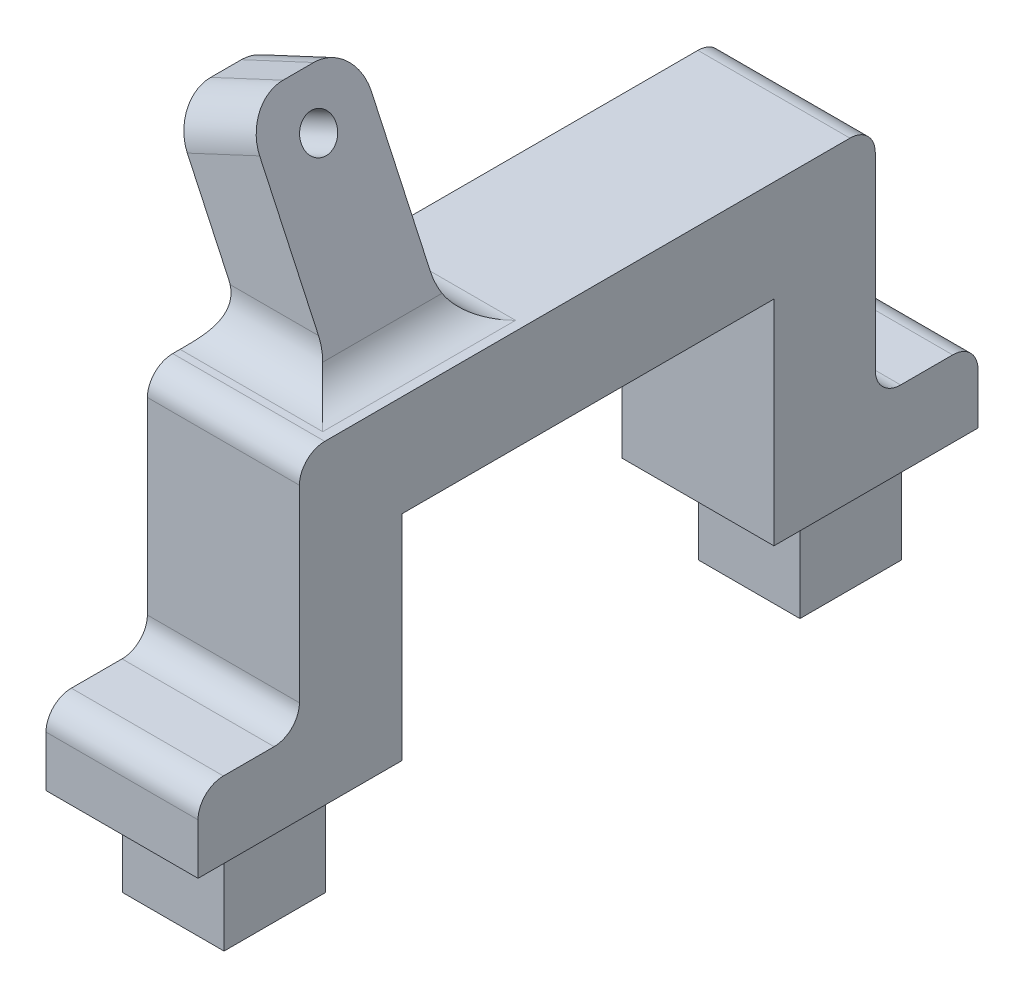
from build123d import *

# Parameters (mm, degrees)
BOSS_EXTRUDE1_DEPTH     = 9.525
SKETCH3_R               = 0.508
CUT_EXTRUDE2_DEPTH      = 6.35
FILLET1_R               = 1.5875
ESQUISSE1_W             = 6.35
ESQUISSE1_H             = 6.35
BOSS_EXTRU_1_DEPTH      = 6.35
ESQUISSE2_W             = 7
ESQUISSE2_H             = 5
BOSS_EXTRU_2_DEPTH      = 15
ESQUISSE3_R             = 1.1
ENL_V_MAT_EXTRU_1_DEPTH = 58.756287679
CONG_1_R                = 2.54


with BuildPart() as part:
    # Sketch1 → Boss-Extrude1 (new body)
    with BuildSketch(Plane(origin=(0, 0, 0), x_dir=(0, 0, -1), z_dir=(1, 0, 0))):
        Polygon((0, 0), (12.7847852, 0), (12.7847852, 13.390245), (36.0778552, 13.390245), (36.0778552, 0), (48.8626404, 0), (48.8626404, 4.7625), (42.4278552, 4.7625), (42.4278552, 19.740245), (41.4309052, 19.740245), (6.3509652, 19.740245), (6.3509652, 4.7625), (0, 4.7625), align=None)
    extrude(amount=BOSS_EXTRUDE1_DEPTH)

    # Sketch3 → Cut-Extrude2 (cut)
    with BuildSketch(Plane.ZY):
        with Locations((-38.3232152, 6.68528)):
            Circle(SKETCH3_R)
        with Locations((-10.5229152, 6.6951225)):
            Circle(SKETCH3_R)
    extrude(amount=-CUT_EXTRUDE2_DEPTH, mode=Mode.SUBTRACT)

    # Fillet1
    fillet1_edges = [part.edges().sort_by_distance(p)[0] for p in [
        (4.7625, 4.7625, 0),
        (4.7625, 4.7625, -6.3509652),
        (4.7625, 19.740245, -6.3509652),
        (4.7625, 19.740245, -42.4278552),
        (4.7625, 4.7625, -42.4278552),
        (4.7625, 4.7625, -48.8626404),
    ]]
    fillet(fillet1_edges, radius=FILLET1_R)

    # Esquisse1 → Boss.-Extru.1 (add)
    with BuildSketch(Plane.XZ):
        with Locations((4.7625, -42.4702478)):
            Rectangle(ESQUISSE1_W, ESQUISSE1_H)
        with Locations((4.7625, -6.3923926)):
            Rectangle(ESQUISSE1_W, ESQUISSE1_H)
    extrude(amount=BOSS_EXTRU_1_DEPTH)

    # Esquisse2 → Boss.-Extru.2 (add)
    with BuildSketch(Plane(origin=(-5.859728485, 12.566228289, 0), x_dir=(0, 0, 1), z_dir=(0.4226182617389464, -0.9063077870374674, 0))):
        with Locations((-14.4384652, -12.4751697)):
            Rectangle(ESQUISSE2_W, ESQUISSE2_H)
    extrude(amount=-BOSS_EXTRU_2_DEPTH)

    # Esquisse3 → Enlèv. mat.-Extru.1 (cut, through all)
    with BuildSketch(Plane(origin=(9.040573976, 4.215688879, 0), x_dir=(0, 0, 1), z_dir=(-0.9063077870367755, -0.4226182617404302, 0))):
        with Locations(Location((-14.4384652, 25.865298818, 0), (0, 0, 270))):
            Circle(ESQUISSE3_R)
    extrude(amount=-ENL_V_MAT_EXTRU_1_DEPTH, mode=Mode.SUBTRACT)

    # Congé1
    # the kernel refuses this fillet: 2.54 mm, written as the material it adds along each edge
    with BuildSketch(Plane(origin=(7.318244162, 19.740245, -10.9384652), x_dir=(1, 0, 0), z_dir=(0, 0, -1))) as cong_1_piece_1:
        with BuildLine():
            CenterArc((CONG_1_R * 0.637070260809, -CONG_1_R), CONG_1_R, 90, 65)
            Line((-CONG_1_R * 0.269237526229, -CONG_1_R * 0.577381738261), (0, 0))
            Line((0, 0), (CONG_1_R * 0.637070260809, 0))
        make_face()
    extrude(amount=7)
    with BuildSketch(Plane(origin=(-4.548645433, 19.740245, -10.9384652), x_dir=(0, 0, 1), z_dir=(1, 0, 0))) as cong_1_piece_2_section:
        with BuildLine():
            CenterArc((CONG_1_R, -CONG_1_R), CONG_1_R, 90, 90)
            Line((0, -CONG_1_R), (0, 0))
            Line((0, 0), (CONG_1_R, 0))
        make_face()
    cong_1_piece_2 = extrude(amount=18.216889595, mode=Mode.PRIVATE)
    cong_1_piece_2 = split(cong_1_piece_2, bisect_by=Plane(origin=(5.198744163, 24.285527416, -10.9384652), z_dir=(-0.9063077870374674, -0.4226182617389464, 0)), keep=Keep.TOP, mode=Mode.PRIVATE)
    cong_1_piece_2 = split(cong_1_piece_2, bisect_by=Plane(origin=(0.667205228, 22.172436107, -10.9384652), z_dir=(0.9063077870374674, 0.4226182617389464, 0)), keep=Keep.TOP, mode=Mode.PRIVATE)
    add(cong_1_piece_2)
    with BuildSketch(Plane(origin=(1.801354567, 19.740245, -17.9384652), x_dir=(-1, 0, 0), z_dir=(0, 0, 1))) as cong_1_piece_3:
        with BuildLine():
            CenterArc((3.626366432, -1.766615888), CONG_1_R, 135.931485235, 69.068514765)
            Line((1.324344653, -2.840066273), (0, 0))
            Line((0, 0), (1.801354567, 0))
        make_face()
    extrude(amount=7)
    with BuildSketch(Plane(origin=(13.668244162, 19.740245, -17.9384652), x_dir=(0, 0, -1), z_dir=(-1, 0, 0))) as cong_1_piece_4_section:
        with BuildLine():
            CenterArc((CONG_1_R, -CONG_1_R), CONG_1_R, 90, 90)
            Line((0, -CONG_1_R), (0, 0))
            Line((0, 0), (CONG_1_R, 0))
        make_face()
    cong_1_piece_4 = extrude(amount=18.216889595, mode=Mode.PRIVATE)
    cong_1_piece_4 = split(cong_1_piece_4, bisect_by=Plane(origin=(8.452393501, 17.308053893, -17.9384652), z_dir=(-0.9063077870374674, -0.4226182617389464, 0)), keep=Keep.TOP, mode=Mode.PRIVATE)
    cong_1_piece_4 = split(cong_1_piece_4, bisect_by=Plane(origin=(3.920854566, 15.194962584, -17.9384652), z_dir=(0.9063077870374674, 0.4226182617389464, 0)), keep=Keep.TOP, mode=Mode.PRIVATE)
    add(cong_1_piece_4)
    with BuildSketch(Plane(origin=(7.318244162, 19.740245, -6.893069044), x_dir=(1, 0, 0), z_dir=(0, 0, -1))) as cong_1_piece_5a_section:
        with BuildLine():
            CenterArc((CONG_1_R * 0.637070260809, -CONG_1_R), CONG_1_R, 90, 65)
            Line((-CONG_1_R * 0.269237526229, -CONG_1_R * 0.577381738261), (0, 0))
            Line((0, 0), (CONG_1_R * 0.637070260809, 0))
        make_face()
    cong_1_piece_5a = extrude(amount=11.045396156, mode=Mode.PRIVATE)
    cong_1_piece_5a = split(cong_1_piece_5a, bisect_by=Plane(origin=(7.318244162, 19.740245, -10.9384652), z_dir=(0, 0, 1)), keep=Keep.TOP, mode=Mode.PRIVATE)
    with BuildSketch(Plane(origin=(-4.548645433, 19.740245, -10.9384652), x_dir=(0, 0, 1), z_dir=(1, 0, 0))) as cong_1_piece_5b_section:
        with BuildLine():
            CenterArc((CONG_1_R, -CONG_1_R), CONG_1_R, 90, 90)
            Line((0, -CONG_1_R), (0, 0))
            Line((0, 0), (CONG_1_R, 0))
        make_face()
    cong_1_piece_5b = extrude(amount=18.216889595, mode=Mode.PRIVATE)
    cong_1_piece_5b = split(cong_1_piece_5b, bisect_by=Plane(origin=(9.525, 19.740245, -10.9384652), z_dir=(-1, 0, 0)), keep=Keep.TOP, mode=Mode.PRIVATE)
    cong_1_piece_5b = split(cong_1_piece_5b, bisect_by=Plane(origin=(5.198744163, 24.285527416, -10.9384652), z_dir=(0.9063077870374674, 0.4226182617389464, 0)), keep=Keep.TOP, mode=Mode.PRIVATE)
    cong_1_piece_5 = cong_1_piece_5a & cong_1_piece_5b
    add(cong_1_piece_5)
    with BuildSketch(Plane(origin=(13.668244162, 19.740245, -17.9384652), x_dir=(0, 0, -1), z_dir=(-1, 0, 0))) as cong_1_piece_6a_section:
        with BuildLine():
            CenterArc((CONG_1_R, -CONG_1_R), CONG_1_R, 90, 90)
            Line((0, -CONG_1_R), (0, 0))
            Line((0, 0), (CONG_1_R, 0))
        make_face()
    cong_1_piece_6a = extrude(amount=18.216889595, mode=Mode.PRIVATE)
    cong_1_piece_6a = split(cong_1_piece_6a, bisect_by=Plane(origin=(9.525, 19.740245, -17.9384652), z_dir=(-1, 0, 0)), keep=Keep.TOP, mode=Mode.PRIVATE)
    cong_1_piece_6a = split(cong_1_piece_6a, bisect_by=Plane(origin=(8.452393501, 17.308053893, -17.9384652), z_dir=(0.9063077870374674, 0.4226182617389464, 0)), keep=Keep.TOP, mode=Mode.PRIVATE)
    with BuildSketch(Plane(origin=(7.318244162, 19.740245, -10.9384652), x_dir=(1, 0, 0), z_dir=(0, 0, -1))) as cong_1_piece_6b_section:
        with BuildLine():
            CenterArc((CONG_1_R * 0.637070260809, -CONG_1_R), CONG_1_R, 90, 65)
            Line((-CONG_1_R * 0.269237526229, -CONG_1_R * 0.577381738261), (0, 0))
            Line((0, 0), (CONG_1_R * 0.637070260809, 0))
        make_face()
    cong_1_piece_6b = extrude(amount=11.045396156, mode=Mode.PRIVATE)
    cong_1_piece_6b = split(cong_1_piece_6b, bisect_by=Plane(origin=(7.318244162, 19.740245, -17.9384652), z_dir=(0, 0, -1)), keep=Keep.TOP, mode=Mode.PRIVATE)
    cong_1_piece_6 = cong_1_piece_6a & cong_1_piece_6b
    add(cong_1_piece_6)
    with BuildSketch(Plane(origin=(-4.548645433, 19.740245, -10.9384652), x_dir=(0, 0, 1), z_dir=(1, 0, 0))) as cong_1_piece_7a_section:
        with BuildLine():
            CenterArc((CONG_1_R, -CONG_1_R), CONG_1_R, 90, 90)
            Line((0, -CONG_1_R), (0, 0))
            Line((0, 0), (CONG_1_R, 0))
        make_face()
    cong_1_piece_7a = extrude(amount=18.216889595, mode=Mode.PRIVATE)
    cong_1_piece_7a = split(cong_1_piece_7a, bisect_by=Plane(origin=(0, 19.740245, -10.9384652), z_dir=(1, 0, 0)), keep=Keep.TOP, mode=Mode.PRIVATE)
    cong_1_piece_7a = split(cong_1_piece_7a, bisect_by=Plane(origin=(0.667205228, 22.172436107, -10.9384652), z_dir=(-0.9063077870374674, -0.4226182617389464, 0)), keep=Keep.TOP, mode=Mode.PRIVATE)
    with BuildSketch(Plane(origin=(1.801354567, 19.740245, -17.9384652), x_dir=(-1, 0, 0), z_dir=(0, 0, 1))) as cong_1_piece_7b_section:
        with BuildLine():
            CenterArc((3.626366432, -1.766615888), CONG_1_R, 135.931485235, 69.068514765)
            Line((1.324344653, -2.840066273), (0, 0))
            Line((0, 0), (1.801354567, 0))
        make_face()
    cong_1_piece_7b = extrude(amount=14.834166034, mode=Mode.PRIVATE)
    cong_1_piece_7b = split(cong_1_piece_7b, bisect_by=Plane(origin=(1.801354567, 19.740245, -10.9384652), z_dir=(0, 0, 1)), keep=Keep.TOP, mode=Mode.PRIVATE)
    cong_1_piece_7 = cong_1_piece_7a & cong_1_piece_7b
    add(cong_1_piece_7)
    with BuildSketch(Plane(origin=(13.668244162, 19.740245, -17.9384652), x_dir=(0, 0, -1), z_dir=(-1, 0, 0))) as cong_1_piece_8a_section:
        with BuildLine():
            CenterArc((CONG_1_R, -CONG_1_R), CONG_1_R, 90, 90)
            Line((0, -CONG_1_R), (0, 0))
            Line((0, 0), (CONG_1_R, 0))
        make_face()
    cong_1_piece_8a = extrude(amount=18.216889595, mode=Mode.PRIVATE)
    cong_1_piece_8a = split(cong_1_piece_8a, bisect_by=Plane(origin=(0, 19.740245, -17.9384652), z_dir=(1, 0, 0)), keep=Keep.TOP, mode=Mode.PRIVATE)
    cong_1_piece_8a = split(cong_1_piece_8a, bisect_by=Plane(origin=(3.920854566, 15.194962584, -17.9384652), z_dir=(-0.9063077870374674, -0.4226182617389464, 0)), keep=Keep.TOP, mode=Mode.PRIVATE)
    with BuildSketch(Plane(origin=(1.801354567, 19.740245, -25.772631234), x_dir=(-1, 0, 0), z_dir=(0, 0, 1))) as cong_1_piece_8b_section:
        with BuildLine():
            CenterArc((3.626366432, -1.766615888), CONG_1_R, 135.931485235, 69.068514765)
            Line((1.324344653, -2.840066273), (0, 0))
            Line((0, 0), (1.801354567, 0))
        make_face()
    cong_1_piece_8b = extrude(amount=14.834166034, mode=Mode.PRIVATE)
    cong_1_piece_8b = split(cong_1_piece_8b, bisect_by=Plane(origin=(1.801354567, 19.740245, -17.9384652), z_dir=(0, 0, -1)), keep=Keep.TOP, mode=Mode.PRIVATE)
    cong_1_piece_8 = cong_1_piece_8a & cong_1_piece_8b
    add(cong_1_piece_8)
    # the kernel refuses this fillet: 2.54 mm, written as the material it takes off along each edge
    with BuildSketch(Plane(origin=(7.128164948, 35.173251244, -17.9384652), x_dir=(0, 0, 1), z_dir=(-0.9063077870374675, -0.42261826173894645, 0)), Plane(origin=(-8.913482883, 27.692908011, -10.9384652), x_dir=(0, 0, -1), z_dir=(0.9063077870374675, 0.42261826173894645, 0))) as cong_1_2_piece_1:
        with BuildLine():
            CenterArc((CONG_1_R, -CONG_1_R), CONG_1_R, 90, 90)
            Line((0, -CONG_1_R), (0, 0))
            Line((0, 0), (CONG_1_R, 0))
        make_face()
    extrude(amount=17.7, mode=Mode.SUBTRACT)


solid = part.part
